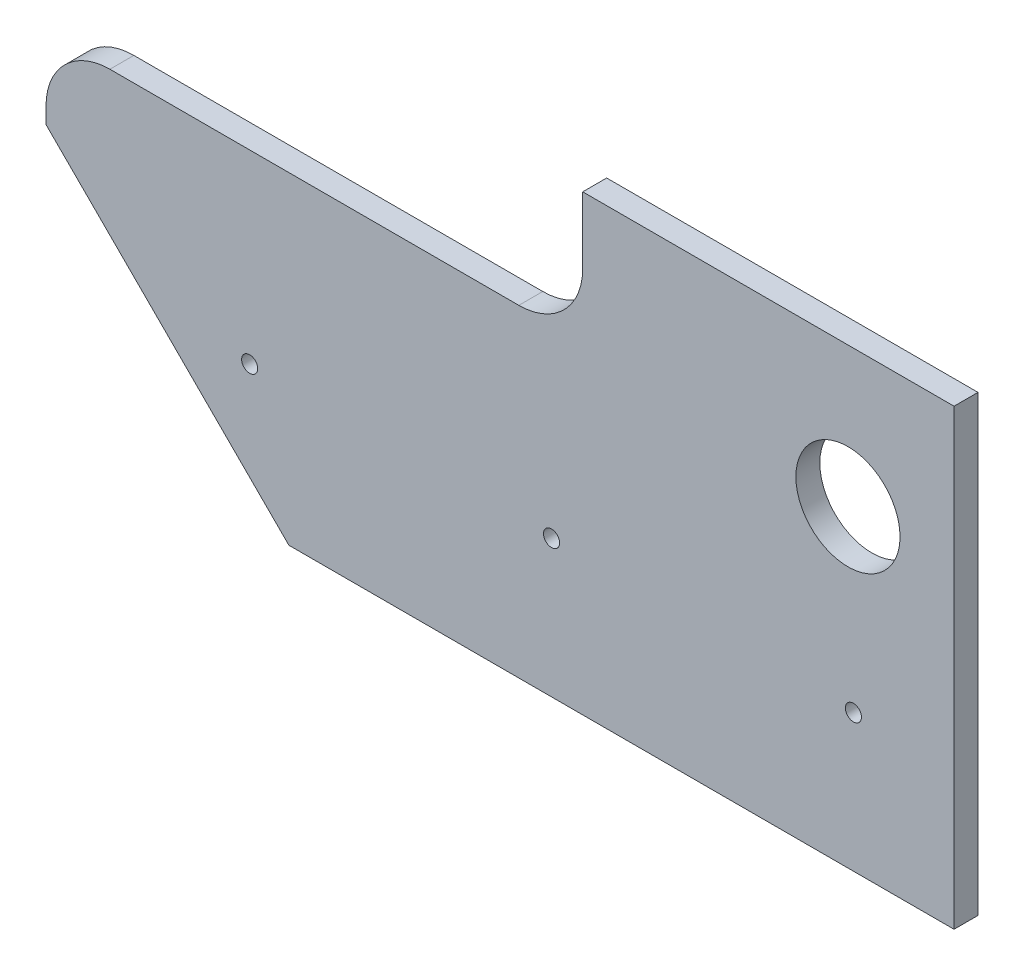
from build123d import *

# Parameters (mm, degrees)
SKETCH1_R                  = 20.701
BOSS_EXTRUDE1_DEPTH        = 9.525
SKETCH2_W                  = 285.57287806
SKETCH2_H                  = 73.914
CUT_EXTRUDE1_DEPTH         = 267.58430025
SKETCH4_W                  = 213.36
SKETCH4_H                  = 65.465352004
CUT_EXTRUDE2_DEPTH         = 267.58430025
FILLET2_R                  = 25.4
F_6_4_6_4_DIAMETER_HOLE2_D = 6.4
SKETCH16_W                 = 9.525
SKETCH16_H                 = 0.985363282
CUT_EXTRUDE3_DEPTH         = 390.572219806
SKETCH17_W                 = 147.610011278
SKETCH17_H                 = 12.7
CUT_EXTRUDE4_DEPTH         = 267.045158533


with BuildPart() as part:
    # Sketch1 → Boss-Extrude1 (new body)
    with BuildSketch(Plane.XY):
        Polygon((-138.259383474, 48.991487021), (32.210627804, -121.478524257), (222.710627804, -121.478524257), (222.710627804, 146.206839025), (-138.259383474, 146.206839025), align=None)
        with Locations((180.538014078, 76.831975743)):
            Circle(SKETCH1_R, mode=Mode.SUBTRACT)
    extrude(amount=BOSS_EXTRUDE1_DEPTH)

    # Sketch2 → Cut-Extrude1 (cut, through all)
    with BuildSketch(Plane.XY.offset(9.525)):
        with Locations((98.974188774, -84.521524257)):
            Rectangle(SKETCH2_W, SKETCH2_H)
    extrude(amount=-CUT_EXTRUDE1_DEPTH, mode=Mode.SUBTRACT)

    # Sketch4 → Cut-Extrude2 (cut, through all)
    with BuildSketch(Plane.XY.offset(9.525)):
        with Locations((-31.579383474, 113.474163023)):
            Rectangle(SKETCH4_W, SKETCH4_H)
    extrude(amount=-CUT_EXTRUDE2_DEPTH, mode=Mode.SUBTRACT)

    # Fillet2
    fillet2_edges = [part.edges().sort_by_distance(p)[0] for p in [
        (-138.259383474, 80.741487021, 4.7625),
        (75.100616526, 80.741487021, 4.7625),
    ]]
    fillet(fillet2_edges, radius=FILLET2_R)

    # Ø6.4 (6.4) Diameter Hole2 (through all)
    with Locations(Plane(origin=(0, 0, 0), x_dir=(-1, 0, 0), z_dir=(0, 0, -1))):
        with Locations((-182.710627794, 7.042935743), (-62.710627794, 7.042935743), (57.289372206, 7.042935743)):
            Hole(F_6_4_6_4_DIAMETER_HOLE2_D / 2)

    # Sketch16 → Cut-Extrude3 (cut, through all)
    with BuildSketch(Plane(origin=(222.710627804, 0, 0), x_dir=(0, 0, -1), z_dir=(1, 0, 0))):
        with Locations((-4.7625, 145.714157384)):
            Rectangle(SKETCH16_W, SKETCH16_H)
    extrude(amount=-CUT_EXTRUDE3_DEPTH, mode=Mode.SUBTRACT)

    # Sketch17 → Cut-Extrude4 (cut, through all)
    with BuildSketch(Plane(origin=(0, 0, 0), x_dir=(-1, 0, 0), z_dir=(0, 0, -1))):
        with Locations((-148.905622165, 138.871475743)):
            Rectangle(SKETCH17_W, SKETCH17_H)
    extrude(amount=-CUT_EXTRUDE4_DEPTH, mode=Mode.SUBTRACT)


solid = part.part
